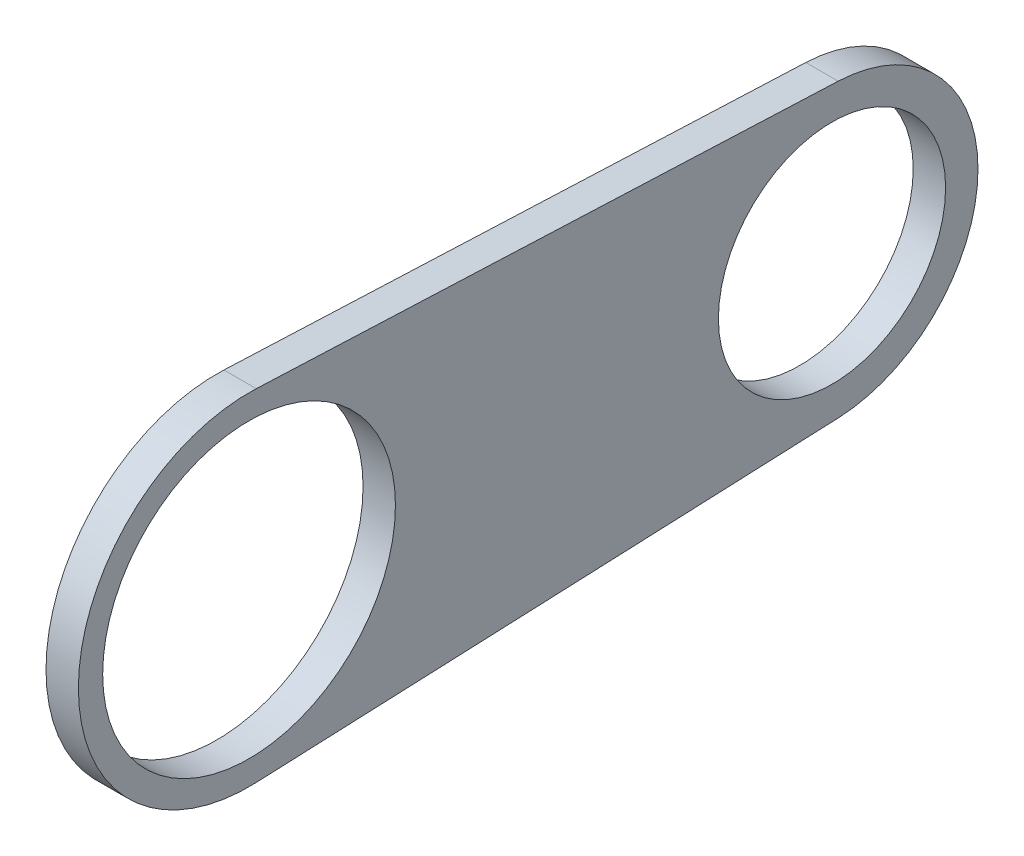
from build123d import *

# Parameters (mm, degrees)
SKETCH1_R           = 14.351
SKETCH1_R_2         = 11.1379
BOSS_EXTRUDE1_DEPTH = 3.175


with BuildPart() as part:
    # Sketch1 → Boss-Extrude1 (new body)
    with BuildSketch(Plane(origin=(0, 0, 0), x_dir=(0, 0, -1), z_dir=(1, 0, 0))):
        with BuildLine():
            Line((-27.866668083, 16.717250251), (29.180912767, 14.300069095))
            ThreePointArc((29.180912767, 14.300069095), (42.8879, 0), (29.180912767, -14.300069095))
            Line((29.180912767, -14.300069095), (-27.866668083, -16.717250251))
            ThreePointArc((-27.866668083, -16.717250251), (-45.30725, 0), (-27.866668083, 16.717250251))
        make_face()
        with Locations((-28.575, 0)):
            Circle(SKETCH1_R, mode=Mode.SUBTRACT)
        with Locations((28.575, 0)):
            Circle(SKETCH1_R_2, mode=Mode.SUBTRACT)
    extrude(amount=BOSS_EXTRUDE1_DEPTH)


solid = part.part
